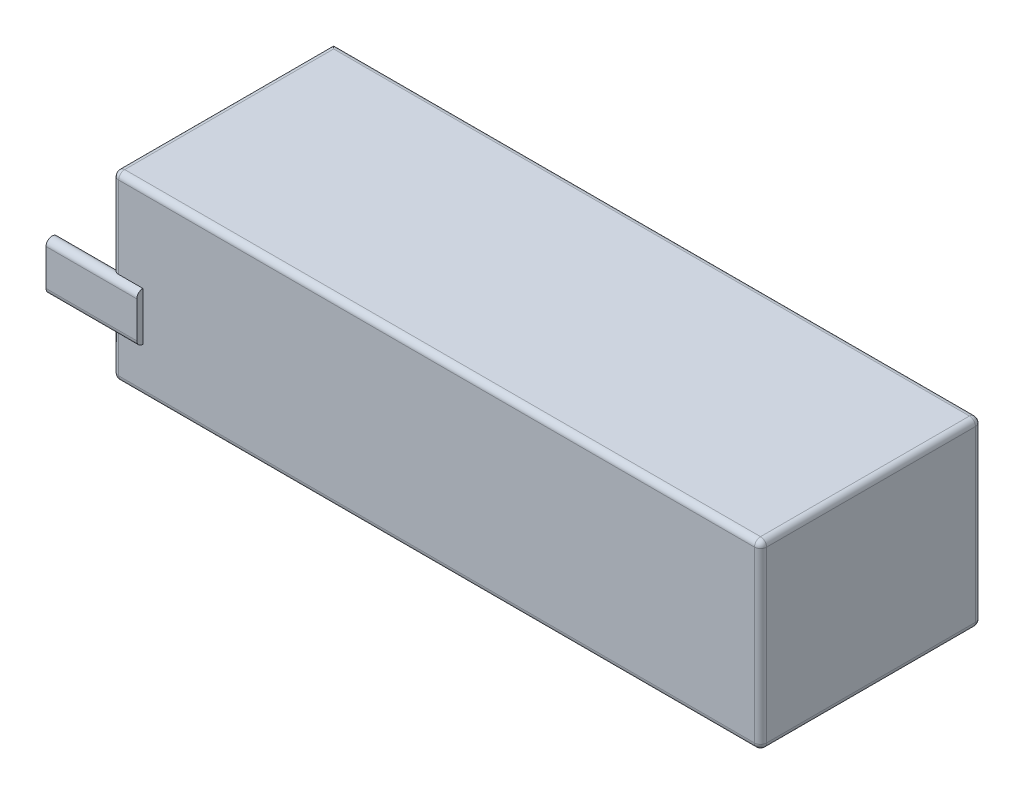
from build123d import *

# Parameters (mm, degrees)
SKETCH1_W            = 107
SKETCH1_H            = 36.5
BATTERY_DEPTH        = 30
CABLES_DEPTH         = 10
CABLES_DEPTH_BACK    = 5
F_1MM_EDGE_FILLETS_R = 1


with BuildPart() as part:
    # Sketch1 → Battery (new body)
    with BuildSketch(Plane(origin=(0, 0, 0), x_dir=(1, 0, 0), z_dir=(0, 1, 0))):
        Rectangle(SKETCH1_W, SKETCH1_H)
    extrude(amount=BATTERY_DEPTH)

    # Sketch2 → Cables (add, two sides: drawn at the far end of the back side and taken through both)
    with BuildSketch(Plane.ZY.offset(53.5).offset(-CABLES_DEPTH_BACK)):
        with BuildLine():
            Line((-21.25, 9.5), (-21.25, 13.5))
            ThreePointArc((-21.25, 13.5), (-19.75, 15), (-18.25, 13.5))
            Line((-18.25, 13.5), (-18.25, 9.5))
            ThreePointArc((-18.25, 9.5), (-19.75, 8), (-21.25, 9.5))
        make_face()
        with BuildLine():
            Line((17.25, 8.5), (17.25, 14.5))
            ThreePointArc((17.25, 14.5), (18.25, 15.5), (19.25, 14.5))
            Line((19.25, 14.5), (19.25, 8.5))
            ThreePointArc((19.25, 8.5), (18.25, 7.5), (17.25, 8.5))
        make_face()
    extrude(amount=CABLES_DEPTH + CABLES_DEPTH_BACK)

    # 1mm Edge Fillets
    f_1mm_edge_fillets_edges = [part.edges().sort_by_distance(p)[0] for p in [
        (0, 0, 18.25),
        (0, 0, -18.25),
        (-53.5, 0, 0),
        (0, 30, -18.25),
        (0, 30, 18.25),
        (-53.5, 30, 0),
        (53.5, 15, 18.25),
        (53.5, 30, 0),
        (53.5, 15, -18.25),
        (53.5, 0, 0),
        (-53.5, 3.75, 18.25),
        (-53.5, 22.75, 18.25),
    ]]
    fillet(f_1mm_edge_fillets_edges, radius=F_1MM_EDGE_FILLETS_R - 0.0001)  # a hair under: the kernel refuses the full size


solid = part.part
